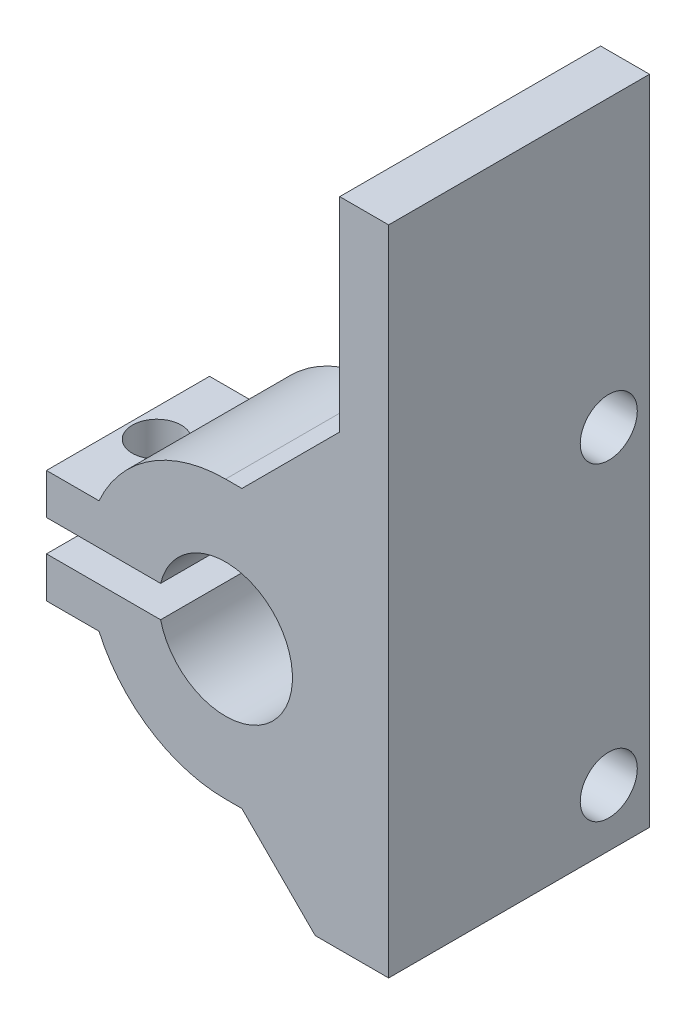
from build123d import *

# Parameters (mm, degrees)
RESSALTO_EXTRUS_O1_DEPTH = 10
ESBO_O2_R                = 3.25
CORTE_EXTRUS_O1_DEPTH    = 10
ESBO_O3_R                = 1.5
CORTE_EXTRUS_O2_DEPTH    = 10
CORTE_EXTRUS_O3_START    = 10
ESBO_O4_R                = 3.25
CORTE_EXTRUS_O3_DEPTH    = 10
ESBO_O5_W                = 16
ESBO_O5_H                = 40
ESBO_O5_R                = 1.75
RESSALTO_EXTRUS_O2_DEPTH = 4
CHANFRO1_SIZE            = 5
CHANFRO2_SIZE            = 5
CHANFRO3_SIZE            = 1


with BuildPart() as part:
    # Esboço1 → Ressalto-extrusão1 (new body)
    with BuildSketch(Plane.XY):
        with BuildLine():
            Line((0, 8.5), (8.5, 8.5))
            Line((8.5, 8.5), (8.5, 0))
            Line((8.5, 0), (8.5, -8.5))
            Line((8.5, -8.5), (0, -8.5))
            ThreePointArc((0, -8.5), (-4.626013402, -7.130918594), (-7.761817645, -3.464705882))
            Line((-7.761817645, -3.464705882), (-10.984889326, -3.464705686))
            Line((-10.984889326, -3.464705686), (-10.984889326, -0.964705686))
            Line((-10.984889326, -0.964705686), (-3.984889326, -0.964705686))
            ThreePointArc((-3.984889326, -0.964705686), (4.1, -1.01e-07), (-3.984889278, 0.964705882))
            Line((-3.984889278, 0.964705882), (-10.984889278, 0.964705882))
            Line((-10.984889278, 0.964705882), (-10.984889278, 3.464705882))
            Line((-10.984889278, 3.464705882), (-7.761817645, 3.464705882))
            ThreePointArc((-7.761817645, 3.464705882), (-4.626013402, 7.130918594), (0, 8.5))
        make_face()
    extrude(amount=RESSALTO_EXTRUS_O1_DEPTH)

    # Esboço2 → Corte-extrusão1 (cut)
    with BuildSketch(Plane(origin=(0, 3.464705882, 0), x_dir=(1, 0, 0), z_dir=(0, 1, 0))):
        with Locations((-9.261817645, -4.955566824)):
            Circle(ESBO_O2_R)
    extrude(amount=CORTE_EXTRUS_O1_DEPTH, mode=Mode.SUBTRACT)

    # Esboço3 → Corte-extrusão2 (cut)
    with BuildSketch(Plane(origin=(0, 3.464705882, 0), x_dir=(1, 0, 0), z_dir=(0, 1, 0))):
        with Locations(Location((-9.261817645, -4.955566824, 0), (0, 0, 180))):
            Circle(ESBO_O3_R)
    extrude(amount=-CORTE_EXTRUS_O2_DEPTH, mode=Mode.SUBTRACT)

    # Esboço4 → Corte-extrusão3 (cut)
    with BuildSketch(Plane(origin=(-2.11e-07, -3.464706354, 0), x_dir=(-0.9999999999999982, 6.08161782252128e-08, 0), z_dir=(-6.081617822521279e-08, -0.9999999999999981, 0)).offset(CORTE_EXTRUS_O3_START)):
        with Locations((9.261817434, -4.955566824)):
            Circle(ESBO_O4_R)
    extrude(amount=-CORTE_EXTRUS_O3_DEPTH, mode=Mode.SUBTRACT)

    # Esboço5 → Ressalto-extrusão2 (add)
    with BuildSketch(Plane(origin=(6, 0, 0), x_dir=(0, 0, -1), z_dir=(1, 0, 0))):
        with Locations((-2, 7)):
            Rectangle(ESBO_O5_W, ESBO_O5_H)
        with Locations((3.5, 9.5)):
            Circle(ESBO_O5_R, mode=Mode.SUBTRACT)
        with Locations((3.5, -9.5)):
            Circle(ESBO_O5_R, mode=Mode.SUBTRACT)
    extrude(amount=RESSALTO_EXTRUS_O2_DEPTH)

    # Chanfro1
    chanfro1_edges = [part.edges().sort_by_distance(p)[0] for p in [
        (6, 8.5, 5),
    ]]
    chamfer(chanfro1_edges, length=CHANFRO1_SIZE)

    # Chanfro2
    # the kernel refuses this chamfer: 5 mm, written as the material it adds along each edge
    with BuildSketch(Plane(origin=(6, -8.5, 10), x_dir=(-0.9996219169112968, 0.027495876610586317, 0), z_dir=(0, 0, -1))) as chanfro2_piece_1_section:
        Polygon((CHANFRO2_SIZE * 0.999621916911, -CHANFRO2_SIZE * 0.0274958766106), (-CHANFRO2_SIZE * 0.0274958766106, -CHANFRO2_SIZE * 0.999621916911), (0, 0), align=None)
    chanfro2_piece_1 = extrude(amount=10, mode=Mode.PRIVATE)
    chanfro2_piece_1 = split(chanfro2_piece_1, bisect_by=Plane(origin=(4.320496265, -13, 5), z_dir=(0, 1, 0)), keep=Keep.TOP, mode=Mode.PRIVATE)
    add(chanfro2_piece_1)

    # Chanfro3
    # the kernel refuses this chamfer: 1 mm, written as the material it takes off along each edge
    with BuildSketch(Plane(origin=(6, -13, -8.571682988), x_dir=(-0.02749587661058651, 0.9996219169112968, 0), z_dir=(0, 0, 1))) as chanfro3_piece_1:
        Polygon((CHANFRO3_SIZE * 0.999621916911, -CHANFRO3_SIZE * 0.0274958766106), (-CHANFRO3_SIZE * 0.0274958766106, -CHANFRO3_SIZE * 0.999621916911), (0, 0), align=None)
    extrude(amount=8.571682988, mode=Mode.SUBTRACT)
    with BuildSketch(Plane(origin=(6, 10.928317012, 10), x_dir=(-0.02749587661058651, 0, -0.9996219169112968), z_dir=(0, 1, 0))) as chanfro3_piece_2_section:
        Polygon((CHANFRO3_SIZE * 0.999621916911, -CHANFRO3_SIZE * 0.0274958766106), (-CHANFRO3_SIZE * 0.0274958766106, -CHANFRO3_SIZE * 0.999621916911), (0, 0), align=None)
    chanfro3_piece_2 = extrude(amount=18.643365976, mode=Mode.PRIVATE)
    chanfro3_piece_2 = split(chanfro3_piece_2, bisect_by=Plane(origin=(10.262240478, 17.762240478, 9.668049788), z_dir=(-0.7071067811865476, 0.7071067811865476, 0)), keep=Keep.TOP, mode=Mode.PRIVATE)
    add(chanfro3_piece_2, mode=Mode.SUBTRACT)
    with BuildSketch(Plane(origin=(6, 29.571682988, -6), x_dir=(-0.027495876610586487, 0, 0.9996219169112968), z_dir=(0, -1, 0))) as chanfro3_piece_3:
        Polygon((CHANFRO3_SIZE * 0.999621916911, -CHANFRO3_SIZE * 0.0274958766106), (-CHANFRO3_SIZE * 0.0274958766106, -CHANFRO3_SIZE * 0.999621916911), (0, 0), align=None)
    extrude(amount=45.143365976, mode=Mode.SUBTRACT)
    with BuildSketch(Plane(origin=(6, 27, 12.571682988), x_dir=(-0.02749587661058651, -0.9996219169112968, 0), z_dir=(0, 0, -1))) as chanfro3_piece_4:
        Polygon((CHANFRO3_SIZE * 0.999621916911, -CHANFRO3_SIZE * 0.0274958766106), (-CHANFRO3_SIZE * 0.0274958766106, -CHANFRO3_SIZE * 0.999621916911), (0, 0), align=None)
    extrude(amount=21.143365976, mode=Mode.SUBTRACT)


solid = part.part
